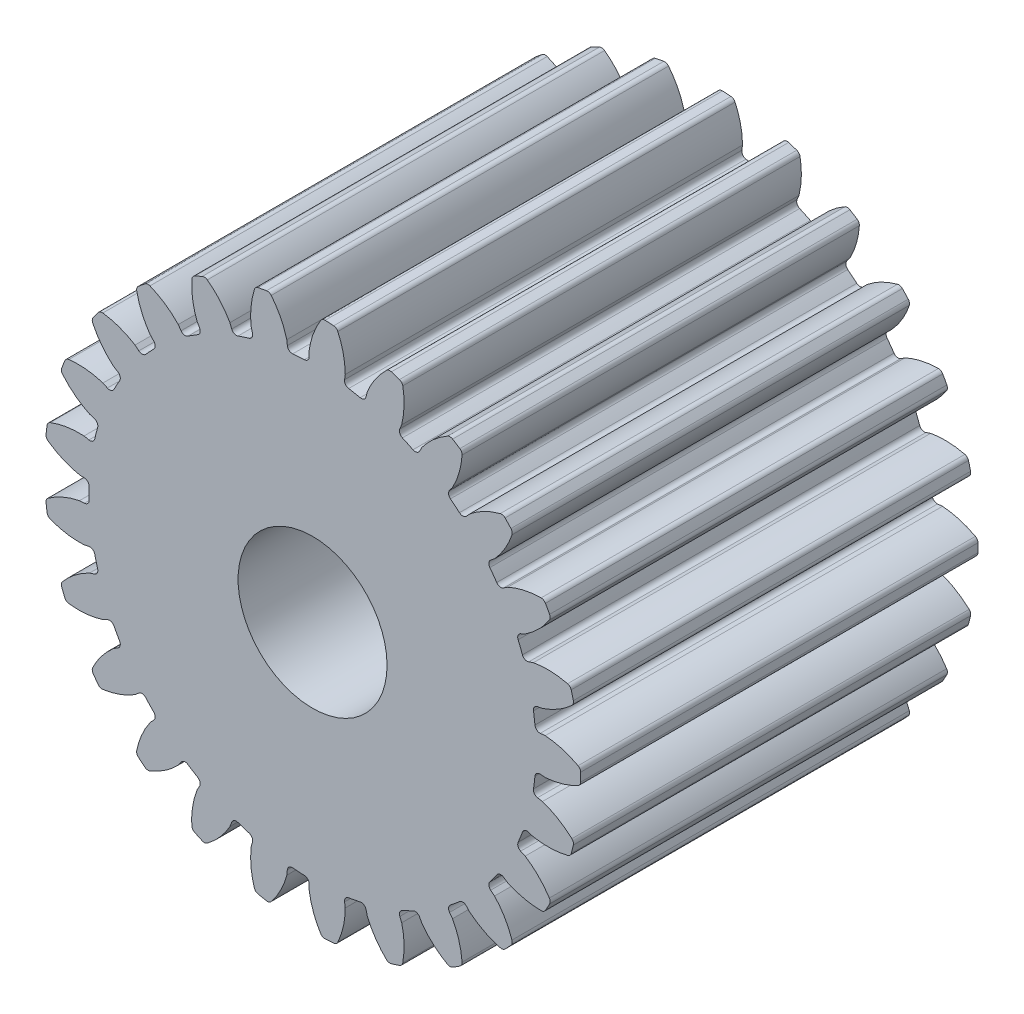
from build123d import *

# Parameters (mm, degrees)
SKETCH_1_R                       = 4.5
SKETCH_1_R_2                     = 1.5
EXTRUDE_1_DEPTH                  = 4
EXTRUDE_2_DEPTH                  = 4
FILLET_1_R                       = 0.1
PATTERN_CIRCULAR_1_COUNT         = 25
FILLET_1_OF_PATTERN_CIRCULAR_1_R = 0.1


with BuildPart() as part:
    # Эскиз1 → Бобышка-Вытянуть1 (new, symmetric)
    with BuildSketch(Plane.XY):
        Circle(SKETCH_1_R)
        Circle(SKETCH_1_R_2, mode=Mode.SUBTRACT)
    extrude(amount=EXTRUDE_1_DEPTH, both=True)

    # Эскиз2 → Бобышка-Вытянуть2 (add, symmetric)
    with BuildSketch(Plane.XY):
        with BuildLine():
            Line((-0.070025105, 4.697941254), (-0.067067244, 4.499500193))
            ThreePointArc((-0.067067244, 4.499500193), (0.282557338, 4.491120278), (0.630475308, 4.455614535))
            Line((0.630475308, 4.455614535), (0.658281105, 4.652120111))
            add(Edge.make_bspline(
                [(0.658281105, 4.652120111), (0.654668824, 5.03383098), (0.482611094, 5.378390701)],
                knots=[0, 0, 0, 1, 1, 1], degree=2))
            ThreePointArc((0.482611094, 5.378390701), (0.339068805, 5.389344334), (0.195285537, 5.396467693))
            add(Edge.make_bspline(
                [(-0.070025105, 4.697941254), (-0.018600251, 5.07618948), (0.195285537, 5.396467693)],
                knots=[0, 0, 0, 1, 1, 1], degree=2))
        make_face()
    extrude_2 = extrude(amount=EXTRUDE_2_DEPTH, both=True)

    # Скругление1
    fillet_1_edges = [part.edges().sort_by_distance(p)[0] for p in [
        (-0.067067244, 4.499500193, 0),
        (0.630475308, 4.455614535, 0),
        (0.482611094, 5.378390701, 2),
        (0.195285537, 5.396467693, -2),
    ]]
    fillet(fillet_1_edges, radius=FILLET_1_R)

    # Круговой массив1: Бобышка-Вытянуть2 ×25 about axis
    pattern_circular_1_axis = Axis((0, 0, 4), (0, 0, -1))
    for i in range(1, PATTERN_CIRCULAR_1_COUNT):
        add(extrude_2.rotate(pattern_circular_1_axis, i * 360 / PATTERN_CIRCULAR_1_COUNT))

    # Скругление1 of Круговой массив1
    fillet_1_of_pattern_circular_1_edges = [part.edges().sort_by_distance(p)[0] for p in [
        (1.054019992, 4.374819066, 0),
        (1.718734042, 4.158840378, 0),
        (1.805000355, 5.089398168, 2),
        (1.531197224, 5.178362199, -2),
        (2.108879275, 3.975251967, 0),
        (2.698998396, 3.600750985, 0),
        (3.013974806, 4.480620032, 2),
        (2.770898159, 4.634881163, -2),
        (3.031229918, 3.325905168, 0),
        (3.509674755, 2.816413165, 0),
        (4.033570135, 3.59030806, 2),
        (3.836493371, 3.800173498, -2),
        (3.763117237, 2.467579515, 0),
        (4.099825341, 1.855109748, 0),
        (4.799721419, 2.474403828, 2),
        (4.661027595, 2.726686956, -2),
        (4.25855406, 1.454206765, 0),
        (4.432368822, 0.777242962, 0),
        (5.264288553, 1.203023703, 2),
        (5.192692314, 1.481872644, -2),
        (4.48641027, 0.349460857, 0),
        (4.48641027, -0.349460857, 0),
        (5.398081077, -0.143946825, 2),
        (5.398081077, 0.143946825, -2),
        (4.432368822, -0.777242962, 0),
        (4.25855406, -1.454206765, 0),
        (5.192692314, -1.481872644, 2),
        (5.264288553, -1.203023703, -2),
        (4.099825341, -1.855109748, 0),
        (3.763117237, -2.467579515, 0),
        (4.661027595, -2.726686956, 2),
        (4.799721419, -2.474403828, -2),
        (3.509674755, -2.816413165, 0),
        (3.031229918, -3.325905168, 0),
        (3.836493371, -3.800173498, 2),
        (4.033570135, -3.59030806, -2),
        (2.698998396, -3.600750985, 0),
        (2.108879275, -3.975251967, 0),
        (2.770898159, -4.634881163, 2),
        (3.013974806, -4.480620032, -2),
        (1.718734042, -4.158840378, 0),
        (1.054019992, -4.374819066, 0),
        (1.531197224, -5.178362199, 2),
        (1.805000355, -5.089398168, -2),
        (0.630475308, -4.455614535, 0),
        (-0.067067244, -4.499500193, 0),
        (0.195285537, -5.396467693, 2),
        (0.482611094, -5.378390701, -2),
        (-0.49739851, -4.472426044, 0),
        (-1.183940399, -4.341461175, 0),
        (-1.152896659, -5.275493275, 2),
        (-0.870102398, -5.329439165, -2),
        (-1.594018949, -4.208218577, 0),
        (-2.226422224, -3.910632184, 0),
        (-2.428638118, -4.823040213, 2),
        (-2.168144156, -4.945619367, -2),
        (-2.590481316, -3.679593259, 0),
        (-3.129009752, -3.234083792, 0),
        (-3.551779312, -4.067537796, 2),
        (-3.329953442, -4.251048115, -2),
        (-3.424174214, -2.919765565, 0),
        (-3.83499009, -2.35432602, 0),
        (-4.451749149, -3.05645702, 2),
        (-4.282529508, -3.289367875, -2),
        (-4.042713653, -1.976478261, 0),
        (-4.300003897, -1.326637286, 0),
        (-5.071999215, -1.853327809, 2),
        (-4.966018494, -2.121004555, -2),
        (-4.407234526, -0.90900156, 0),
        (-4.494832644, -0.215591052, 0),
        (-5.373556916, -0.533747195, 2),
        (-5.337474274, -0.819370717, -2),
        (-4.494832644, 0.215591052, 0),
        (-4.407234526, 0.90900156, 0),
        (-5.337474274, 0.819370717, 2),
        (-5.373556916, 0.533747195, -2),
        (-4.300003897, 1.326637286, 0),
        (-4.042713653, 1.976478261, 0),
        (-4.966018494, 2.121004555, 2),
        (-5.071999215, 1.853327809, -2),
        (-3.83499009, 2.35432602, 0),
        (-3.424174214, 2.919765565, 0),
        (-4.282529508, 3.289367875, 2),
        (-4.451749149, 3.05645702, -2),
        (-3.129009752, 3.234083792, 0),
        (-2.590481316, 3.679593259, 0),
        (-3.329953442, 4.251048115, 2),
        (-3.551779312, 4.067537796, -2),
        (-2.226422224, 3.910632184, 0),
        (-1.594018949, 4.208218577, 0),
        (-2.168144156, 4.945619367, 2),
        (-2.428638118, 4.823040213, -2),
        (-1.183940399, 4.341461175, 0),
        (-0.49739851, 4.472426044, 0),
        (-0.870102398, 5.329439165, 2),
        (-1.152896659, 5.275493275, -2),
    ]]
    fillet(fillet_1_of_pattern_circular_1_edges, radius=FILLET_1_OF_PATTERN_CIRCULAR_1_R)


solid = part.part
